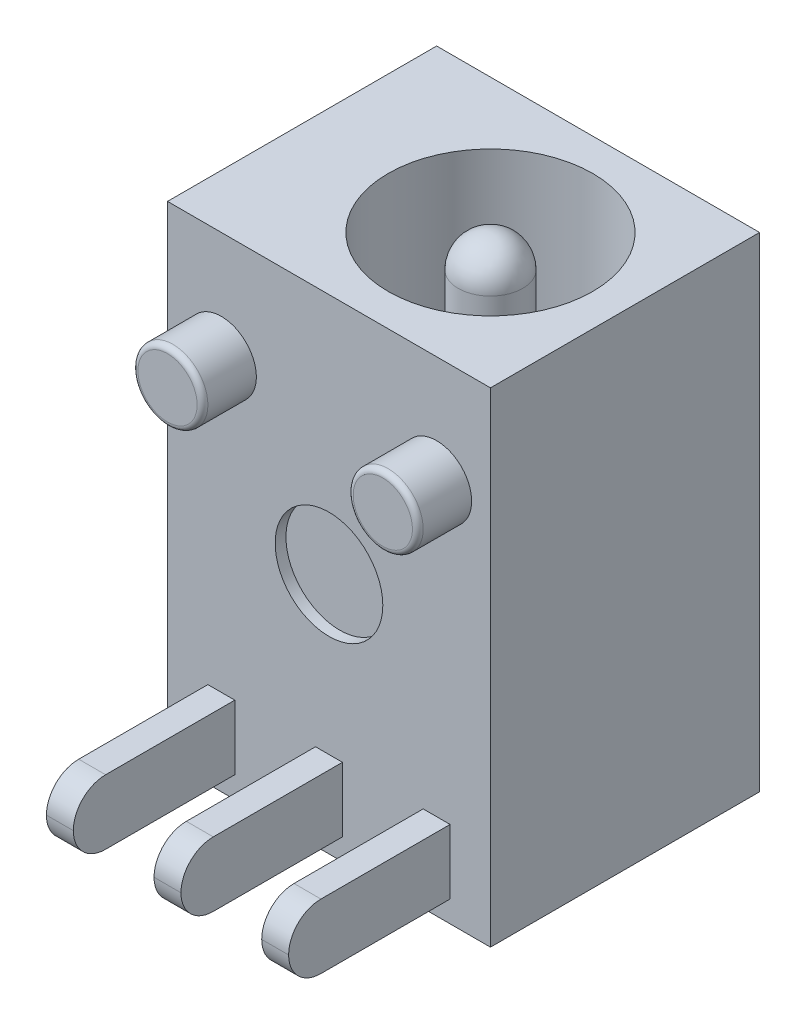
from build123d import *

# Parameters (mm, degrees)
SKETCH2_W           = 6
SKETCH2_H           = 5
BOSS_EXTRUDE1_DEPTH = 9
SKETCH3_R           = 1.9
SKETCH3_R_2         = 0.6
CUT_EXTRUDE1_DEPTH  = 7
FILLET1_R           = 0.6
SKETCH4_W           = 0.5
SKETCH4_H           = 1.2
BOSS_EXTRUDE2_DEPTH = 3
FILLET2_R           = 0.6
SKETCH5_R           = 0.65
BOSS_EXTRUDE3_DEPTH = 1
FILLET3_R           = 0.1
SKETCH6_R           = 1
CUT_EXTRUDE2_DEPTH  = 0.2


with BuildPart() as part:
    # Sketch2 → Boss-Extrude1 (new body)
    with BuildSketch(Plane(origin=(0, 0, 0), x_dir=(1, 0, 0), z_dir=(0, 1, 0))):
        Rectangle(SKETCH2_W, SKETCH2_H)
    extrude(amount=BOSS_EXTRUDE1_DEPTH)

    # Sketch3 → Cut-Extrude1 (cut)
    with BuildSketch(Plane(origin=(0, 9, 0), x_dir=(1, 0, 0), z_dir=(0, 1, 0))):
        with Locations(Location((0.5, 0, 0), (0, 0, 270))):
            Circle(SKETCH3_R)
        with Locations(Location((0.5, 0, 0), (0, 0, 270))):
            Circle(SKETCH3_R_2, mode=Mode.SUBTRACT)
    extrude(amount=-CUT_EXTRUDE1_DEPTH, mode=Mode.SUBTRACT)

    # Fillet1
    fillet1_edges = [part.edges().sort_by_distance(p)[0] for p in [
        (0.5, 9, -0.6),
    ]]
    fillet(fillet1_edges, radius=FILLET1_R)

    # Sketch4 → Boss-Extrude2 (add)
    with BuildSketch(Plane.XY.offset(2.5)):
        with Locations((2, 1)):
            Rectangle(SKETCH4_W, SKETCH4_H)
        with Locations((0, 1)):
            Rectangle(SKETCH4_W, SKETCH4_H)
        with Locations((-2, 1)):
            Rectangle(SKETCH4_W, SKETCH4_H)
    extrude(amount=BOSS_EXTRUDE2_DEPTH)

    # Fillet2
    fillet2_edges = [part.edges().sort_by_distance(p)[0] for p in [
        (-2, 0.4, 5.5),
        (-2, 1.6, 5.5),
        (0, 1.6, 5.5),
        (0, 0.4, 5.5),
        (2, 0.4, 5.5),
        (2, 1.6, 5.5),
    ]]
    fillet(fillet2_edges, radius=FILLET2_R - 0.0001)  # a hair under: the kernel refuses the full size

    # Sketch5 → Boss-Extrude3 (add)
    with BuildSketch(Plane.XY.offset(2.5)):
        with Locations(Location((2, 7, 0), (0, 0, 180))):
            Circle(SKETCH5_R)
        with Locations(Location((-2, 7, 0), (0, 0, 180))):
            Circle(SKETCH5_R)
    extrude(amount=BOSS_EXTRUDE3_DEPTH)

    # Fillet3
    fillet3_edges = [part.edges().sort_by_distance(p)[0] for p in [
        (2.65, 7, 3.5),
        (-1.35, 7, 3.5),
    ]]
    fillet(fillet3_edges, radius=FILLET3_R)

    # Sketch6 → Cut-Extrude2 (cut)
    with BuildSketch(Plane.XY.offset(2.5)):
        with Locations((0, 4.5)):
            Circle(SKETCH6_R)
    extrude(amount=-CUT_EXTRUDE2_DEPTH, mode=Mode.SUBTRACT)


solid = part.part
